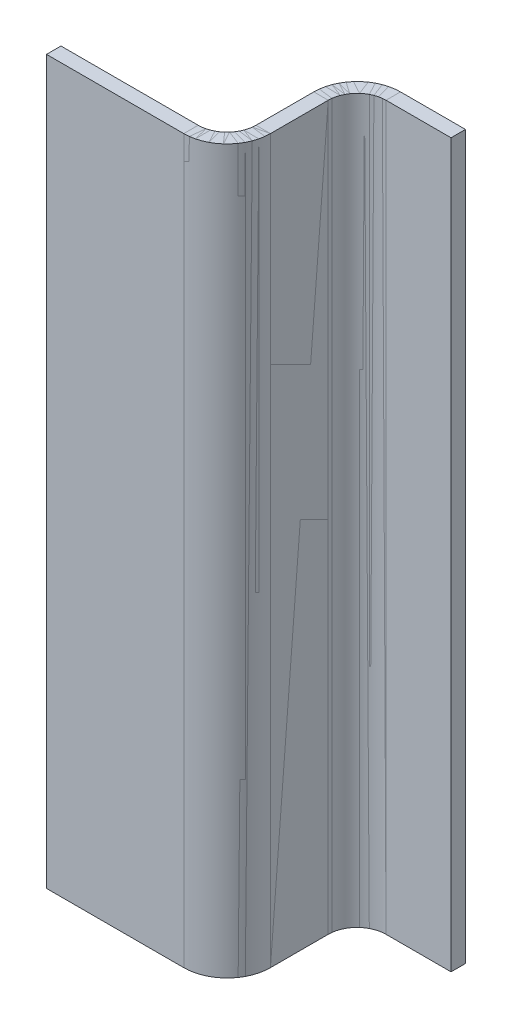
from build123d import *

# Parameters (mm, degrees)
SKETCH1_W            = 100
SKETCH1_H            = 2
CONVERT_SOLID3_START = -50
CONVERT_SOLID3_DEPTH = 100


# Read off the part's stored shape, not the designer's step: Convert-Solid3
with BuildPart() as part:
    # Sweep1: sweep along a path in Sketch2
    with BuildLine(Plane(origin=(0, 0, 0), x_dir=(1, 0, 0), z_dir=(0, 1, 0))) as sweep1_path:
        Line((0, 0), (19, 0))
        ThreePointArc((19, 0), (22.535533906, 1.464466094), (24, 5))
        Line((24, 5), (24, 13))
        ThreePointArc((24, 13), (25.464466094, 16.535533906), (29, 18))
        Line((29, 18), (38, 18))
    # Sketch1 → Sweep1 (sweep)
    with BuildSketch(Plane.YZ):
        Rectangle(SKETCH1_W, SKETCH1_H)
    sweep(path=sweep1_path.line)


with BuildPart() as body_2:
    # Convert-Solid3 outline → Convert-Solid3 (new body)
    with BuildSketch(Plane(origin=(0, 0, 0), x_dir=(1, 0, 0), z_dir=(0, 1, 0)).offset(CONVERT_SOLID3_START)):
        with BuildLine():
            Line((0, 1), (0, -1))
            Line((0, -1), (19, -1))
            ThreePointArc((19, -1), (23.242640687, 0.757359313), (25, 5))
            Line((25, 5), (25, 13))
            ThreePointArc((25, 13), (26.171572875, 15.828427125), (29, 17))
            Line((29, 17), (38, 17))
            Line((38, 17), (38, 19))
            Line((38, 19), (29, 19))
            ThreePointArc((29, 19), (24.757359313, 17.242640687), (23, 13))
            Line((23, 13), (23, 5))
            ThreePointArc((23, 5), (21.828427125, 2.171572875), (19, 1))
            Line((19, 1), (0, 1))
        make_face()
    extrude(amount=CONVERT_SOLID3_DEPTH)


solid = Compound([part.part, body_2.part])
